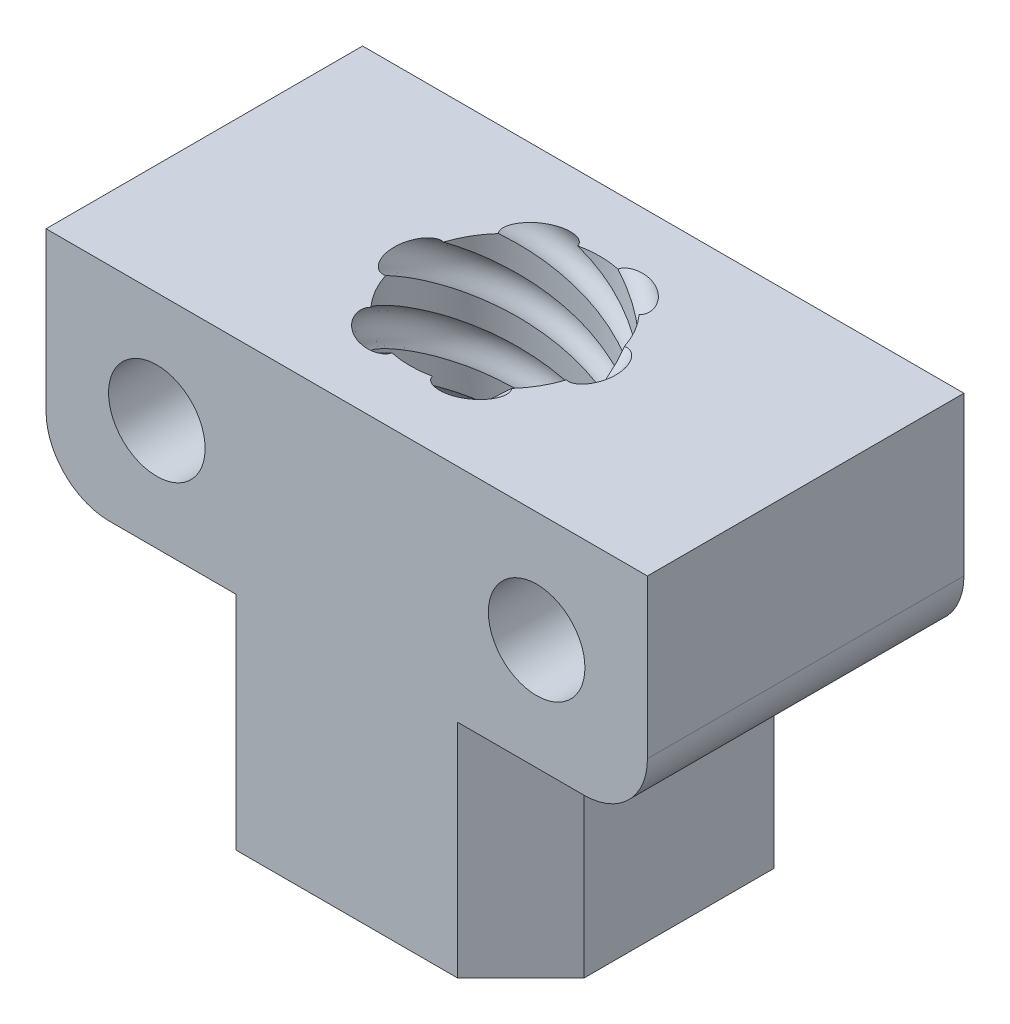
from build123d import *

# Parameters (mm, degrees)
EXTRUDE_1_DEPTH     = 10
SKETCH_2_R          = 3
CUT_EXTRUDE_1_DEPTH = 26
SWEEP_2_PITCH       = 12
SWEEP_3_PITCH       = 12
SWEEP_4_PITCH       = 12
SWEEP_5_PITCH       = 12
SWEEP_6_PITCH       = 12
SWEEP_7_PITCH       = 12
SKETCH_15_R         = 1.525
CUT_EXTRUDE_2_DEPTH = 26
FILLET_1_R          = 2
CHAMFER_1_SIZE      = 2


with BuildPart() as part:
    # 草图1 → 凸台-拉伸1 (new body)
    with BuildSketch(Plane.XY):
        Polygon((-5.5, -4.766101695), (5.5, -4.766101695), (5.5, 2.233898305), (9.5, 2.233898305), (9.5, 9.233898305), (-9.5, 9.233898305), (-9.5, 2.233898305), (-5.5, 2.233898305), align=None)
    extrude(amount=EXTRUDE_1_DEPTH)

    # 草图2 → 切除-拉伸1 (cut)
    with BuildSketch(Plane(origin=(0, 9.233898305, 0), x_dir=(1, 0, 0), z_dir=(0, 1, 0))):
        with Locations(Location((0, -5, 0), (0, 0, 180))):
            Circle(SKETCH_2_R)
    extrude(amount=-CUT_EXTRUDE_1_DEPTH, mode=Mode.SUBTRACT)

    # 切除-扫描2: arcs per turn and ends read off the stored shape
    # 切除-扫描2: the profile of 切除-扫描2 profile screwed along a right-hand helix through 11 turns, 16 arcs to a turn; built about Z, then put on its axis
    sweep_2_z = Axis((0, 0, 0), (0, 0, 1))
    sweep_2_corners = [(3, -0.268514636, -11.578218196), (3.5, 0, -12), (3, 0.268514636, -12.421781804), (2.5, 0, -12)]
    with BuildLine(mode=Mode.PRIVATE) as sweep_2_profile:
        ThreePointArc((3, -0.268514636, -11.578218196), (3.353553391, -0.18986852, -11.701755226), (3.5, 0, -12))
        ThreePointArc((3.5, 0, -12), (3.353553391, 0.18986852, -12.298244774), (3, 0.268514636, -12.421781804))
        ThreePointArc((3, 0.268514636, -12.421781804), (2.646446609, 0.18986852, -12.298244774), (2.5, 0, -12))
        ThreePointArc((2.5, 0, -12), (2.646446609, -0.18986852, -11.701755226), (3, -0.268514636, -11.578218196))
    sweep_2_cap = Face(sweep_2_profile.wire())
    sweep_2_arcs = [((3, -0.268514636, -11.578218196), (3.5, -0.268514636, -11.578218196), (3.5, 0, -12), (1, 0.7071067811865476, 1)), ((3.5, 0, -12), (3.5, 0.268514636, -12.421781804), (3, 0.268514636, -12.421781804), (1, 0.7071067811865476, 1)), ((3, 0.268514636, -12.421781804), (2.5, 0.268514636, -12.421781804), (2.5, 0, -12), (1, 0.7071067811865476, 1)), ((2.5, 0, -12), (2.5, -0.268514636, -11.578218196), (3, -0.268514636, -11.578218196), (1, 0.7071067811865476, 1))]  # start, shoulder, end, weights
    sweep_2_turn_angles = [0, 11.25, 22.5, 33.75, 45, 56.25, 67.5, 78.75, 90, 101.25, 112.5, 123.75, 135, 146.25, 157.5, 168.75, 180, 191.25, 202.5, 213.75, 225, 236.25, 247.5, 258.75, 270, 281.25, 292.5, 303.75, 315, 326.25, 337.5, 348.75, 360]
    sweep_2_turn_weights = [1, 0.9807852804032304, 1, 0.9807852804032304, 1, 0.9807852804032304, 1, 0.9807852804032304, 1, 0.9807852804032304, 1, 0.9807852804032304, 1, 0.9807852804032304, 1, 0.9807852804032304, 1, 0.9807852804032304, 1, 0.9807852804032304, 1, 0.9807852804032304, 1, 0.9807852804032304, 1, 0.9807852804032304, 1, 0.9807852804032304, 1, 0.9807852804032304, 1, 0.9807852804032304, 1]
    sweep_2_turn_sides = [Face.make_bezier_surface([[Vector(p[j][0], p[j][1], 0).rotate(sweep_2_z, sweep_2_turn_angles[2 * i + k]) / sweep_2_turn_weights[2 * i + k] + Vector(0, 0, p[j][2] + SWEEP_2_PITCH * sweep_2_turn_angles[2 * i + k] / 360) for k in range(3)] for j in range(3)], [[p[3][j] * sweep_2_turn_weights[2 * i + k] for k in range(3)] for j in range(3)]) for p in sweep_2_arcs for i in range(16)]
    sweep_2 = Plane(origin=(0, 9.233898305, 5), x_dir=(-1, 0, 0), z_dir=(0, -1, 0)) * Solid(Shell([*[p.moved(Location((0, 0, SWEEP_2_PITCH * i))) for i in range(11) for p in sweep_2_turn_sides], sweep_2_cap, sweep_2_cap.rotate(sweep_2_z, 3960).moved(Location((0, 0, SWEEP_2_PITCH * 3960 / 360)))]))
    add(sweep_2, mode=Mode.SUBTRACT)

    # 切除-扫描3: arcs per turn and ends read off the stored shape
    # 切除-扫描3: the profile of 切除-扫描3 profile screwed along a right-hand helix through 3 turns, 16 arcs to a turn; built about Z, then put on its axis
    sweep_3_z = Axis((0, 0, 0), (0, 0, 1))
    sweep_3_corners = [(2.851927089, -0.256469805, -11.597138172), (3.47757137, -0.079519488, -11.875091081), (3.148072911, 0.256469805, -12.402861828), (2.52242863, 0.079519488, -12.124908919)]
    with BuildLine(mode=Mode.PRIVATE) as sweep_3_profile:
        ThreePointArc((2.851927089, -0.256469805, -11.597138172), (3.232990594, -0.237580307, -11.626809726), (3.47757137, -0.079519488, -11.875091081))
        ThreePointArc((3.47757137, -0.079519488, -11.875091081), (3.442397313, 0.125122769, -12.196542387), (3.148072911, 0.256469805, -12.402861828))
        ThreePointArc((3.148072911, 0.256469805, -12.402861828), (2.767009406, 0.237580307, -12.373190274), (2.52242863, 0.079519488, -12.124908919))
        ThreePointArc((2.52242863, 0.079519488, -12.124908919), (2.557602687, -0.125122769, -11.803457613), (2.851927089, -0.256469805, -11.597138172))
    sweep_3_cap = Face(sweep_3_profile.wire())
    sweep_3_arcs = [((2.851927089, -0.256469805, -11.597138172), (3.329498459, -0.335989293, -11.472229253), (3.47757137, -0.079519488, -11.875091081), (1, 0.7071067811865476, 1)), ((3.47757137, -0.079519488, -11.875091081), (3.625644281, 0.176950317, -12.277952909), (3.148072911, 0.256469805, -12.402861828), (1, 0.7071067811865476, 1)), ((3.148072911, 0.256469805, -12.402861828), (2.670501541, 0.335989293, -12.527770747), (2.52242863, 0.079519488, -12.124908919), (1, 0.7071067811865476, 1)), ((2.52242863, 0.079519488, -12.124908919), (2.374355719, -0.176950317, -11.722047091), (2.851927089, -0.256469805, -11.597138172), (1, 0.7071067811865476, 1))]  # start, shoulder, end, weights
    sweep_3_turn_angles = [0, 11.25, 22.5, 33.75, 45, 56.25, 67.5, 78.75, 90, 101.25, 112.5, 123.75, 135, 146.25, 157.5, 168.75, 180, 191.25, 202.5, 213.75, 225, 236.25, 247.5, 258.75, 270, 281.25, 292.5, 303.75, 315, 326.25, 337.5, 348.75, 360]
    sweep_3_turn_weights = [1, 0.9807852804032304, 1, 0.9807852804032304, 1, 0.9807852804032304, 1, 0.9807852804032304, 1, 0.9807852804032304, 1, 0.9807852804032304, 1, 0.9807852804032304, 1, 0.9807852804032304, 1, 0.9807852804032304, 1, 0.9807852804032304, 1, 0.9807852804032304, 1, 0.9807852804032304, 1, 0.9807852804032304, 1, 0.9807852804032304, 1, 0.9807852804032304, 1, 0.9807852804032304, 1]
    sweep_3_turn_sides = [Face.make_bezier_surface([[Vector(p[j][0], p[j][1], 0).rotate(sweep_3_z, sweep_3_turn_angles[2 * i + k]) / sweep_3_turn_weights[2 * i + k] + Vector(0, 0, p[j][2] + SWEEP_3_PITCH * sweep_3_turn_angles[2 * i + k] / 360) for k in range(3)] for j in range(3)], [[p[3][j] * sweep_3_turn_weights[2 * i + k] for k in range(3)] for j in range(3)]) for p in sweep_3_arcs for i in range(16)]
    sweep_3 = Plane(origin=(0, 9.233898305, 5), x_dir=(-0.49999999999999806, 0, 0.8660254037844397), z_dir=(0, -1, 0)) * Solid(Shell([*[p.moved(Location((0, 0, SWEEP_3_PITCH * i))) for i in range(3) for p in sweep_3_turn_sides], sweep_3_cap, sweep_3_cap.rotate(sweep_3_z, 1080).moved(Location((0, 0, SWEEP_3_PITCH * 1080 / 360)))]))
    add(sweep_3, mode=Mode.SUBTRACT)

    # 切除-扫描4: arcs per turn and ends read off the stored shape
    # 切除-扫描4: the profile of 切除-扫描4 profile screwed along a right-hand helix through 3 turns, 16 arcs to a turn; built about Z, then put on its axis
    sweep_4_z = Axis((0, 0, 0), (0, 0, 1))
    sweep_4_corners = [(3.148072911, -0.256469805, -11.597138172), (3.47757137, 0.079519488, -12.124908919), (2.851927089, 0.256469805, -12.402861828), (2.52242863, -0.079519488, -11.875091081)]
    with BuildLine(mode=Mode.PRIVATE) as sweep_4_profile:
        ThreePointArc((3.148072911, -0.256469805, -11.597138172), (3.442397313, -0.125122769, -11.803457613), (3.47757137, 0.079519488, -12.124908919))
        ThreePointArc((3.47757137, 0.079519488, -12.124908919), (3.232990594, 0.237580307, -12.373190274), (2.851927089, 0.256469805, -12.402861828))
        ThreePointArc((2.851927089, 0.256469805, -12.402861828), (2.557602687, 0.125122769, -12.196542387), (2.52242863, -0.079519488, -11.875091081))
        ThreePointArc((2.52242863, -0.079519488, -11.875091081), (2.767009406, -0.237580307, -11.626809726), (3.148072911, -0.256469805, -11.597138172))
    sweep_4_cap = Face(sweep_4_profile.wire())
    sweep_4_arcs = [((3.148072911, -0.256469805, -11.597138172), (3.625644281, -0.176950317, -11.722047091), (3.47757137, 0.079519488, -12.124908919), (1, 0.7071067811865476, 1)), ((3.47757137, 0.079519488, -12.124908919), (3.329498459, 0.335989293, -12.527770747), (2.851927089, 0.256469805, -12.402861828), (1, 0.7071067811865476, 1)), ((2.851927089, 0.256469805, -12.402861828), (2.374355719, 0.176950317, -12.277952909), (2.52242863, -0.079519488, -11.875091081), (1, 0.7071067811865476, 1)), ((2.52242863, -0.079519488, -11.875091081), (2.670501541, -0.335989293, -11.472229253), (3.148072911, -0.256469805, -11.597138172), (1, 0.7071067811865476, 1))]  # start, shoulder, end, weights
    sweep_4_turn_angles = [0, 11.25, 22.5, 33.75, 45, 56.25, 67.5, 78.75, 90, 101.25, 112.5, 123.75, 135, 146.25, 157.5, 168.75, 180, 191.25, 202.5, 213.75, 225, 236.25, 247.5, 258.75, 270, 281.25, 292.5, 303.75, 315, 326.25, 337.5, 348.75, 360]
    sweep_4_turn_weights = [1, 0.9807852804032304, 1, 0.9807852804032304, 1, 0.9807852804032304, 1, 0.9807852804032304, 1, 0.9807852804032304, 1, 0.9807852804032304, 1, 0.9807852804032304, 1, 0.9807852804032304, 1, 0.9807852804032304, 1, 0.9807852804032304, 1, 0.9807852804032304, 1, 0.9807852804032304, 1, 0.9807852804032304, 1, 0.9807852804032304, 1, 0.9807852804032304, 1, 0.9807852804032304, 1]
    sweep_4_turn_sides = [Face.make_bezier_surface([[Vector(p[j][0], p[j][1], 0).rotate(sweep_4_z, sweep_4_turn_angles[2 * i + k]) / sweep_4_turn_weights[2 * i + k] + Vector(0, 0, p[j][2] + SWEEP_4_PITCH * sweep_4_turn_angles[2 * i + k] / 360) for k in range(3)] for j in range(3)], [[p[3][j] * sweep_4_turn_weights[2 * i + k] for k in range(3)] for j in range(3)]) for p in sweep_4_arcs for i in range(16)]
    sweep_4 = Plane(origin=(0, 9.233898305, 5), x_dir=(0.5000000000000041, 0, 0.8660254037844364), z_dir=(0, -1, 0)) * Solid(Shell([*[p.moved(Location((0, 0, SWEEP_4_PITCH * i))) for i in range(3) for p in sweep_4_turn_sides], sweep_4_cap, sweep_4_cap.rotate(sweep_4_z, 1080).moved(Location((0, 0, SWEEP_4_PITCH * 1080 / 360)))]))
    add(sweep_4, mode=Mode.SUBTRACT)

    # 切除-扫描5: arcs per turn and ends read off the stored shape
    # 切除-扫描5: the profile of 切除-扫描5 profile screwed along a right-hand helix through 3 turns, 16 arcs to a turn; built about Z, then put on its axis
    sweep_5_z = Axis((0, 0, 0), (0, 0, 1))
    sweep_5_corners = [(3, 0.268514636, -12.421781804), (2.5, 0, -12), (3, -0.268514636, -11.578218196), (3.5, 0, -12)]
    with BuildLine(mode=Mode.PRIVATE) as sweep_5_profile:
        ThreePointArc((3, 0.268514636, -12.421781804), (2.646446609, 0.18986852, -12.298244774), (2.5, 0, -12))
        ThreePointArc((2.5, 0, -12), (2.646446609, -0.18986852, -11.701755226), (3, -0.268514636, -11.578218196))
        ThreePointArc((3, -0.268514636, -11.578218196), (3.353553391, -0.18986852, -11.701755226), (3.5, 0, -12))
        ThreePointArc((3.5, 0, -12), (3.353553391, 0.18986852, -12.298244774), (3, 0.268514636, -12.421781804))
    sweep_5_cap = Face(sweep_5_profile.wire())
    sweep_5_arcs = [((3, 0.268514636, -12.421781804), (2.5, 0.268514636, -12.421781804), (2.5, 0, -12), (1, 0.7071067811865476, 1)), ((2.5, 0, -12), (2.5, -0.268514636, -11.578218196), (3, -0.268514636, -11.578218196), (1, 0.7071067811865476, 1)), ((3, -0.268514636, -11.578218196), (3.5, -0.268514636, -11.578218196), (3.5, 0, -12), (1, 0.7071067811865476, 1)), ((3.5, 0, -12), (3.5, 0.268514636, -12.421781804), (3, 0.268514636, -12.421781804), (1, 0.7071067811865476, 1))]  # start, shoulder, end, weights
    sweep_5_turn_angles = [0, 11.25, 22.5, 33.75, 45, 56.25, 67.5, 78.75, 90, 101.25, 112.5, 123.75, 135, 146.25, 157.5, 168.75, 180, 191.25, 202.5, 213.75, 225, 236.25, 247.5, 258.75, 270, 281.25, 292.5, 303.75, 315, 326.25, 337.5, 348.75, 360]
    sweep_5_turn_weights = [1, 0.9807852804032304, 1, 0.9807852804032304, 1, 0.9807852804032304, 1, 0.9807852804032304, 1, 0.9807852804032304, 1, 0.9807852804032304, 1, 0.9807852804032304, 1, 0.9807852804032304, 1, 0.9807852804032304, 1, 0.9807852804032304, 1, 0.9807852804032304, 1, 0.9807852804032304, 1, 0.9807852804032304, 1, 0.9807852804032304, 1, 0.9807852804032304, 1, 0.9807852804032304, 1]
    sweep_5_turn_sides = [Face.make_bezier_surface([[Vector(p[j][0], p[j][1], 0).rotate(sweep_5_z, sweep_5_turn_angles[2 * i + k]) / sweep_5_turn_weights[2 * i + k] + Vector(0, 0, p[j][2] + SWEEP_5_PITCH * sweep_5_turn_angles[2 * i + k] / 360) for k in range(3)] for j in range(3)], [[p[3][j] * sweep_5_turn_weights[2 * i + k] for k in range(3)] for j in range(3)]) for p in sweep_5_arcs for i in range(16)]
    sweep_5 = Plane(origin=(0, 9.233898305, 5), x_dir=(1, 0, 0), z_dir=(0, -1, 0)) * Solid(Shell([*[p.moved(Location((0, 0, SWEEP_5_PITCH * i))) for i in range(3) for p in sweep_5_turn_sides], sweep_5_cap, sweep_5_cap.rotate(sweep_5_z, 1080).moved(Location((0, 0, SWEEP_5_PITCH * 1080 / 360)))]))
    add(sweep_5, mode=Mode.SUBTRACT)

    # 切除-扫描6: arcs per turn and ends read off the stored shape
    # 切除-扫描6: the profile of 切除-扫描6 profile screwed along a right-hand helix through 3 turns, 16 arcs to a turn; built about Z, then put on its axis
    sweep_6_z = Axis((0, 0, 0), (0, 0, 1))
    sweep_6_corners = [(3.148072911, 0.256469805, -12.402861828), (2.52242863, 0.079519488, -12.124908919), (2.851927089, -0.256469805, -11.597138172), (3.47757137, -0.079519488, -11.875091081)]
    with BuildLine(mode=Mode.PRIVATE) as sweep_6_profile:
        ThreePointArc((3.148072911, 0.256469805, -12.402861828), (2.767009406, 0.237580307, -12.373190274), (2.52242863, 0.079519488, -12.124908919))
        ThreePointArc((2.52242863, 0.079519488, -12.124908919), (2.557602687, -0.125122769, -11.803457613), (2.851927089, -0.256469805, -11.597138172))
        ThreePointArc((2.851927089, -0.256469805, -11.597138172), (3.232990594, -0.237580307, -11.626809726), (3.47757137, -0.079519488, -11.875091081))
        ThreePointArc((3.47757137, -0.079519488, -11.875091081), (3.442397313, 0.125122769, -12.196542387), (3.148072911, 0.256469805, -12.402861828))
    sweep_6_cap = Face(sweep_6_profile.wire())
    sweep_6_arcs = [((3.148072911, 0.256469805, -12.402861828), (2.670501541, 0.335989293, -12.527770747), (2.52242863, 0.079519488, -12.124908919), (1, 0.7071067811865476, 1)), ((2.52242863, 0.079519488, -12.124908919), (2.374355719, -0.176950317, -11.722047091), (2.851927089, -0.256469805, -11.597138172), (1, 0.7071067811865476, 1)), ((2.851927089, -0.256469805, -11.597138172), (3.329498459, -0.335989293, -11.472229253), (3.47757137, -0.079519488, -11.875091081), (1, 0.7071067811865476, 1)), ((3.47757137, -0.079519488, -11.875091081), (3.625644281, 0.176950317, -12.277952909), (3.148072911, 0.256469805, -12.402861828), (1, 0.7071067811865476, 1))]  # start, shoulder, end, weights
    sweep_6_turn_angles = [0, 11.25, 22.5, 33.75, 45, 56.25, 67.5, 78.75, 90, 101.25, 112.5, 123.75, 135, 146.25, 157.5, 168.75, 180, 191.25, 202.5, 213.75, 225, 236.25, 247.5, 258.75, 270, 281.25, 292.5, 303.75, 315, 326.25, 337.5, 348.75, 360]
    sweep_6_turn_weights = [1, 0.9807852804032304, 1, 0.9807852804032304, 1, 0.9807852804032304, 1, 0.9807852804032304, 1, 0.9807852804032304, 1, 0.9807852804032304, 1, 0.9807852804032304, 1, 0.9807852804032304, 1, 0.9807852804032304, 1, 0.9807852804032304, 1, 0.9807852804032304, 1, 0.9807852804032304, 1, 0.9807852804032304, 1, 0.9807852804032304, 1, 0.9807852804032304, 1, 0.9807852804032304, 1]
    sweep_6_turn_sides = [Face.make_bezier_surface([[Vector(p[j][0], p[j][1], 0).rotate(sweep_6_z, sweep_6_turn_angles[2 * i + k]) / sweep_6_turn_weights[2 * i + k] + Vector(0, 0, p[j][2] + SWEEP_6_PITCH * sweep_6_turn_angles[2 * i + k] / 360) for k in range(3)] for j in range(3)], [[p[3][j] * sweep_6_turn_weights[2 * i + k] for k in range(3)] for j in range(3)]) for p in sweep_6_arcs for i in range(16)]
    sweep_6 = Plane(origin=(0, 9.233898305, 5), x_dir=(0.49999999999999195, 0, -0.8660254037844433), z_dir=(0, -1, 0)) * Solid(Shell([*[p.moved(Location((0, 0, SWEEP_6_PITCH * i))) for i in range(3) for p in sweep_6_turn_sides], sweep_6_cap, sweep_6_cap.rotate(sweep_6_z, 1080).moved(Location((0, 0, SWEEP_6_PITCH * 1080 / 360)))]))
    add(sweep_6, mode=Mode.SUBTRACT)

    # 切除-扫描7: arcs per turn and ends read off the stored shape
    # 切除-扫描7: the profile of 切除-扫描7 profile screwed along a right-hand helix through 3 turns, 16 arcs to a turn; built about Z, then put on its axis
    sweep_7_z = Axis((0, 0, 0), (0, 0, 1))
    sweep_7_corners = [(2.851927089, 0.256469805, -12.402861828), (2.52242863, -0.079519488, -11.875091081), (3.148072911, -0.256469805, -11.597138172), (3.47757137, 0.079519488, -12.124908919)]
    with BuildLine(mode=Mode.PRIVATE) as sweep_7_profile:
        ThreePointArc((2.851927089, 0.256469805, -12.402861828), (2.557602687, 0.125122769, -12.196542387), (2.52242863, -0.079519488, -11.875091081))
        ThreePointArc((2.52242863, -0.079519488, -11.875091081), (2.767009406, -0.237580307, -11.626809726), (3.148072911, -0.256469805, -11.597138172))
        ThreePointArc((3.148072911, -0.256469805, -11.597138172), (3.442397313, -0.125122769, -11.803457613), (3.47757137, 0.079519488, -12.124908919))
        ThreePointArc((3.47757137, 0.079519488, -12.124908919), (3.232990594, 0.237580307, -12.373190274), (2.851927089, 0.256469805, -12.402861828))
    sweep_7_cap = Face(sweep_7_profile.wire())
    sweep_7_arcs = [((2.851927089, 0.256469805, -12.402861828), (2.374355719, 0.176950317, -12.277952909), (2.52242863, -0.079519488, -11.875091081), (1, 0.7071067811865476, 1)), ((2.52242863, -0.079519488, -11.875091081), (2.670501541, -0.335989293, -11.472229253), (3.148072911, -0.256469805, -11.597138172), (1, 0.7071067811865476, 1)), ((3.148072911, -0.256469805, -11.597138172), (3.625644281, -0.176950317, -11.722047091), (3.47757137, 0.079519488, -12.124908919), (1, 0.7071067811865476, 1)), ((3.47757137, 0.079519488, -12.124908919), (3.329498459, 0.335989293, -12.527770747), (2.851927089, 0.256469805, -12.402861828), (1, 0.7071067811865476, 1))]  # start, shoulder, end, weights
    sweep_7_turn_angles = [0, 11.25, 22.5, 33.75, 45, 56.25, 67.5, 78.75, 90, 101.25, 112.5, 123.75, 135, 146.25, 157.5, 168.75, 180, 191.25, 202.5, 213.75, 225, 236.25, 247.5, 258.75, 270, 281.25, 292.5, 303.75, 315, 326.25, 337.5, 348.75, 360]
    sweep_7_turn_weights = [1, 0.9807852804032304, 1, 0.9807852804032304, 1, 0.9807852804032304, 1, 0.9807852804032304, 1, 0.9807852804032304, 1, 0.9807852804032304, 1, 0.9807852804032304, 1, 0.9807852804032304, 1, 0.9807852804032304, 1, 0.9807852804032304, 1, 0.9807852804032304, 1, 0.9807852804032304, 1, 0.9807852804032304, 1, 0.9807852804032304, 1, 0.9807852804032304, 1, 0.9807852804032304, 1]
    sweep_7_turn_sides = [Face.make_bezier_surface([[Vector(p[j][0], p[j][1], 0).rotate(sweep_7_z, sweep_7_turn_angles[2 * i + k]) / sweep_7_turn_weights[2 * i + k] + Vector(0, 0, p[j][2] + SWEEP_7_PITCH * sweep_7_turn_angles[2 * i + k] / 360) for k in range(3)] for j in range(3)], [[p[3][j] * sweep_7_turn_weights[2 * i + k] for k in range(3)] for j in range(3)]) for p in sweep_7_arcs for i in range(16)]
    sweep_7 = Plane(origin=(0, 9.233898305, 5), x_dir=(-0.5000000000000101, 0, -0.8660254037844328), z_dir=(0, -1, 0)) * Solid(Shell([*[p.moved(Location((0, 0, SWEEP_7_PITCH * i))) for i in range(3) for p in sweep_7_turn_sides], sweep_7_cap, sweep_7_cap.rotate(sweep_7_z, 1080).moved(Location((0, 0, SWEEP_7_PITCH * 1080 / 360)))]))
    add(sweep_7, mode=Mode.SUBTRACT)

    # 草图15 → 切除-拉伸2 (cut)
    with BuildSketch(Plane.XY.offset(10)):
        with Locations((-6, 5.733898305)):
            Circle(SKETCH_15_R)
        with Locations((6, 5.733898305)):
            Circle(SKETCH_15_R)
    extrude(amount=-CUT_EXTRUDE_2_DEPTH, mode=Mode.SUBTRACT)

    # 圆角1
    fillet_1_edges = [part.edges().sort_by_distance(p)[0] for p in [
        (-9.5, 2.233898305, 5),
        (9.5, 2.233898305, 5),
    ]]
    fillet(fillet_1_edges, radius=FILLET_1_R)

    # 倒角1
    chamfer_1_edges = [part.edges().sort_by_distance(p)[0] for p in [
        (5.5, -1.266101695, 0),
        (-5.5, -1.266101695, 0),
        (5.5, -1.266101695, 10),
        (-5.5, -1.266101695, 10),
    ]]
    chamfer(chamfer_1_edges, length=CHAMFER_1_SIZE)


solid = part.part
